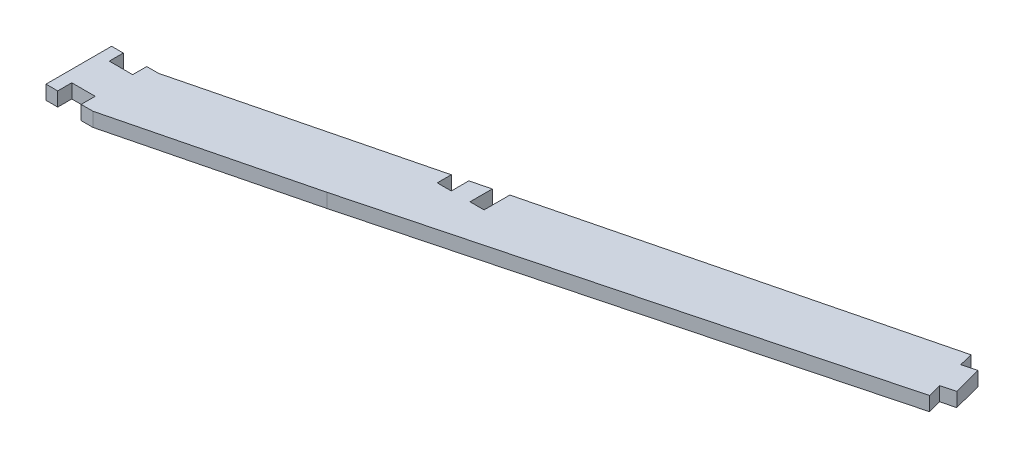
from build123d import *

# Parameters (mm, degrees)
BOSS_EXTRUDE1_DEPTH             = 15
BOSS_EXTRUDE2_REACH             = 1239.023
BOSS_EXTRUDE2_DIRECTION_2_REACH = 1239.023
CUT_EXTRUDE2_DEPTH              = 1238.578280352
CUT_EXTRUDE2_DEPTH_BACK         = 1238.578280352
SKETCH5_W                       = 40
SKETCH5_H                       = 40
CUT_EXTRUDE3_DEPTH              = 1238.578280352
BOSS_EXTRUDE4_DEPTH             = 75
CUT_EXTRUDE4_DEPTH              = 1241.107934819
CUT_EXTRUDE4_DEPTH_BACK         = 1241.107934819
SKETCH8_W                       = 15
SKETCH8_H                       = 73.7
FILLET1_R                       = 5
CUT_EXTRUDE5_DEPTH              = 1241.107934819
CUT_EXTRUDE5_DEPTH_BACK         = 1241.107934819
SKETCH9_W                       = 25
SKETCH9_H                       = 15
SKETCH9_W_2                     = 15
CUT_EXTRUDE6_DEPTH              = 1241.107934819
CUT_EXTRUDE6_DEPTH_BACK         = 1241.107934819
SKETCH10_W                      = 1728.920732784
SKETCH10_H                      = 178.853868908
SKETCH10_W_2                    = 1650
SKETCH10_H_2                    = 15
CUT_EXTRUDE9_DEPTH              = 1238.022635201
CUT_EXTRUDE9_DEPTH_BACK         = 1238.022635201
SKETCH11_W                      = 1852.680615207
SKETCH11_H                      = 1075.927112831


with BuildPart() as part:
    # Sketch1 → Boss-Extrude1 (new body)
    with BuildSketch(Plane(origin=(0, 0, 0), x_dir=(1, 0, 0), z_dir=(0, 1, 0))):
        Polygon((-450, 300), (-400, 300), (-200, 250), (600, 40), (1200, 40), (1200, -40), (600, -40), (-200, -250), (-400, -300), (-450, -300), align=None)
    extrude(amount=BOSS_EXTRUDE1_DEPTH)

    # Boss-Extrude2: up to this face of the body (flat: up to its plane)
    boss_extrude2_end = Plane(part.part.faces().sort_by_distance((-425, 7.5, 300))[0])
    # Sketch2 → Boss-Extrude2 (add, up to the picked face)
    with BuildSketch(Plane.XY, mode=Mode.PRIVATE) as boss_extrude2_sk1:
        with BuildLine():
            Line((-425, 0), (-450, 0))
            Line((-450, 0), (-450, -40))
            Line((-450, -40), (-440, -40))
            Line((-440, -40), (-440, -15))
            ThreePointArc((-440, -15), (-435.606601718, -4.393398282), (-425, 0))
        make_face()
    boss_extrude2_tool1 = split(extrude(boss_extrude2_sk1.sketch, amount=BOSS_EXTRUDE2_REACH, mode=Mode.PRIVATE), bisect_by=boss_extrude2_end, keep=Keep.BOTH, mode=Mode.PRIVATE)
    # Sketch2 → Boss-Extrude2 (add, up to the picked face)
    with BuildSketch(Plane.XY, mode=Mode.PRIVATE) as boss_extrude2_sk2:
        with BuildLine():
            Line((-400, 0), (-425, 0))
            ThreePointArc((-425, 0), (-414.393398282, -4.393398282), (-410, -15))
            Line((-410, -15), (-410, -40))
            Line((-410, -40), (-400, -40))
            Line((-400, -40), (-400, 0))
        make_face()
    boss_extrude2_tool2 = split(extrude(boss_extrude2_sk2.sketch, amount=BOSS_EXTRUDE2_REACH, mode=Mode.PRIVATE), bisect_by=boss_extrude2_end, keep=Keep.BOTH, mode=Mode.PRIVATE)
    add(boss_extrude2_tool1.solids().sort_by(Axis((-444.100555, -18.206662, 0), (0, 0, 1)))[0])
    add(boss_extrude2_tool2.solids().sort_by(Axis((-405.899445, -18.206662, 0), (0, 0, 1)))[0])

    # Boss-Extrude2 direction 2: up to this face of the body (flat: up to its plane)
    boss_extrude2_direction_2_end = Plane(part.part.faces().sort_by_distance((-425, 7.5, -300))[0])
    # Sketch2 → Boss-Extrude2 direction 2 (add, up to the picked face)
    with BuildSketch(Plane.XY, mode=Mode.PRIVATE) as boss_extrude2_direction_2_sk1:
        with BuildLine():
            Line((-425, 0), (-450, 0))
            Line((-450, 0), (-450, -40))
            Line((-450, -40), (-440, -40))
            Line((-440, -40), (-440, -15))
            ThreePointArc((-440, -15), (-435.606601718, -4.393398282), (-425, 0))
        make_face()
    boss_extrude2_direction_2_tool1 = split(extrude(boss_extrude2_direction_2_sk1.sketch, amount=-BOSS_EXTRUDE2_DIRECTION_2_REACH, mode=Mode.PRIVATE), bisect_by=boss_extrude2_direction_2_end, keep=Keep.BOTH, mode=Mode.PRIVATE)
    # Sketch2 → Boss-Extrude2 direction 2 (add, up to the picked face)
    with BuildSketch(Plane.XY, mode=Mode.PRIVATE) as boss_extrude2_direction_2_sk2:
        with BuildLine():
            Line((-400, 0), (-425, 0))
            ThreePointArc((-425, 0), (-414.393398282, -4.393398282), (-410, -15))
            Line((-410, -15), (-410, -40))
            Line((-410, -40), (-400, -40))
            Line((-400, -40), (-400, 0))
        make_face()
    boss_extrude2_direction_2_tool2 = split(extrude(boss_extrude2_direction_2_sk2.sketch, amount=-BOSS_EXTRUDE2_DIRECTION_2_REACH, mode=Mode.PRIVATE), bisect_by=boss_extrude2_direction_2_end, keep=Keep.BOTH, mode=Mode.PRIVATE)
    add(boss_extrude2_direction_2_tool1.solids().sort_by(Axis((-444.100555, -18.206662, 0), (0, 0, -1)))[0])
    add(boss_extrude2_direction_2_tool2.solids().sort_by(Axis((-405.899445, -18.206662, 0), (0, 0, -1)))[0])

    # Sketch4 → Cut-Extrude2 (cut, two sides: drawn at the far end of the back side and taken through both)
    with BuildSketch(Plane(origin=(0, 0, 0), x_dir=(1, 0, 0), z_dir=(0, 1, 0)).offset(-CUT_EXTRUDE2_DEPTH_BACK)):
        Polygon((-450, 230), (-400, 230), (-150, 167.5), (-150, -167.5), (-400, -230), (-450, -230), align=None)
        Polygon((-100, 155), (-100, -155), (520, 0), align=None)
    extrude(amount=CUT_EXTRUDE2_DEPTH + CUT_EXTRUDE2_DEPTH_BACK, mode=Mode.SUBTRACT)

    # Sketch5 → Cut-Extrude3 (cut, through all)
    with BuildSketch(Plane(origin=(0, 0, 0), x_dir=(0, 0, -1), z_dir=(1, 0, 0))):
        with Locations((-265, -20)):
            Rectangle(SKETCH5_W, SKETCH5_H)
        with Locations((265, -20)):
            Rectangle(SKETCH5_W, SKETCH5_H)
    extrude(amount=-CUT_EXTRUDE3_DEPTH, mode=Mode.SUBTRACT)

    # Sketch7 → Boss-Extrude4 (add)
    with BuildSketch(Plane(origin=(1200, 0, 0), x_dir=(0, 0, -1), z_dir=(1, 0, 0))):
        with BuildLine():
            Line((-87.5, 50), (-40, 15))
            Line((-40, 15), (40, 15))
            Line((40, 15), (87.5, 50))
            Line((87.5, 50), (87.5, 88.7))
            Line((87.5, 88.7), (58.5, 88.7))
            Line((58.5, 88.7), (58.5, 63.2))
            Line((58.5, 63.2), (48.5, 63.2))
            Line((48.5, 63.2), (48.5, 88.7))
            Line((48.5, 88.7), (20, 88.7))
            Line((20, 88.7), (20, 50))
            ThreePointArc((20, 50), (0, 30), (-20, 50))
            Line((-20, 50), (-20, 88.7))
            Line((-20, 88.7), (-63, 88.7))
            Line((-63, 88.7), (-63, 63.2))
            Line((-63, 63.2), (-73, 63.2))
            Line((-73, 63.2), (-73, 88.7))
            Line((-73, 88.7), (-87.5, 88.7))
            Line((-87.5, 88.7), (-87.5, 50))
        make_face()
    extrude(amount=-BOSS_EXTRUDE4_DEPTH)

    # Sketch8 → Cut-Extrude4 (cut, two sides: drawn at the far end of the back side and taken through both)
    with BuildSketch(Plane.XY.offset(-CUT_EXTRUDE4_DEPTH_BACK)):
        with Locations((1147.5, 51.85)):
            Rectangle(SKETCH8_W, SKETCH8_H)
        with Locations((1177.5, 51.85)):
            Rectangle(SKETCH8_W, SKETCH8_H)
    extrude(amount=CUT_EXTRUDE4_DEPTH + CUT_EXTRUDE4_DEPTH_BACK, mode=Mode.SUBTRACT)

    # Fillet1
    fillet1_edges = [part.edges().sort_by_distance(p)[0] for p in [
        (1192.5, 50, 87.5),
        (1162.5, 50, 87.5),
        (1132.5, 50, 87.5),
        (1192.5, 50, -87.5),
        (1162.5, 50, -87.5),
        (1132.5, 50, -87.5),
        (1192.5, 88.7, -87.5),
        (1162.5, 88.7, -87.5),
        (1132.5, 88.7, -87.5),
        (1132.5, 88.7, -58.5),
        (1162.5, 88.7, -58.5),
        (1192.5, 88.7, -58.5),
        (1192.5, 88.7, -48.5),
        (1162.5, 88.7, -48.5),
        (1132.5, 88.7, -48.5),
        (1192.5, 88.7, -20),
        (1162.5, 88.7, -20),
        (1132.5, 88.7, -20),
        (1192.5, 88.7, 63),
        (1162.5, 88.7, 63),
        (1132.5, 88.7, 63),
        (1132.5, 88.7, 87.5),
        (1162.5, 88.7, 87.5),
        (1192.5, 88.7, 87.5),
        (1192.5, 88.7, 73),
        (1162.5, 88.7, 73),
        (1132.5, 88.7, 73),
        (1192.5, 88.7, 20),
        (1162.5, 88.7, 20),
        (1132.5, 88.7, 20),
        (600, 7.5, 40),
        (600, 7.5, -40),
        (520, 7.5, 0),
        (-440, -40, -292.5),
        (-440, -40, -237.5),
        (-400, -40, -292.5),
        (-400, -40, -237.5),
        (-450, -40, -237.5),
        (-410, -40, -237.5),
        (-450, -40, -292.5),
        (-410, -40, -292.5),
        (-150, 7.5, 167.5),
        (-100, 7.5, 155),
        (-150, 7.5, -167.5),
        (-100, 7.5, -155),
        (-450, -40, 237.5),
        (-410, -40, 237.5),
        (-440, -40, 237.5),
        (-400, -40, 237.5),
        (-450, -40, 292.5),
        (-440, -40, 292.5),
        (-400, -40, 292.5),
        (-410, -40, 292.5),
    ]]
    fillet(fillet1_edges, radius=FILLET1_R - 0.0001)  # a hair under: the kernel refuses the full size

    # Sketch9 → Cut-Extrude5 (cut, two sides: drawn at the far end of the back side and taken through both)
    with BuildSketch(Plane(origin=(0, 0, 0), x_dir=(1, 0, 0), z_dir=(0, 1, 0)).offset(-CUT_EXTRUDE5_DEPTH_BACK)):
        with Locations((-425, -292.5)):
            Rectangle(SKETCH9_W, SKETCH9_H)
        with Locations((1192.5, -32.5)):
            Rectangle(SKETCH9_W_2, SKETCH9_H)
        with Locations((1192.5, 32.5)):
            Rectangle(SKETCH9_W_2, SKETCH9_H)
        with Locations((1162.5, 32.5)):
            Rectangle(SKETCH9_W_2, SKETCH9_H)
        with Locations((1132.5, 32.5)):
            Rectangle(SKETCH9_W_2, SKETCH9_H)
        with Locations((1132.5, -32.5)):
            Rectangle(SKETCH9_W_2, SKETCH9_H)
        with Locations((1162.5, -32.5)):
            Rectangle(SKETCH9_W_2, SKETCH9_H)
        with Locations((-425, -237.5)):
            Rectangle(SKETCH9_W, SKETCH9_H)
        with Locations((-425, 237.5)):
            Rectangle(SKETCH9_W, SKETCH9_H)
        with Locations((-425, 292.5)):
            Rectangle(SKETCH9_W, SKETCH9_H)
    extrude(amount=CUT_EXTRUDE5_DEPTH + CUT_EXTRUDE5_DEPTH_BACK, mode=Mode.SUBTRACT)


with BuildPart() as cut_extrude5_piece_1:
    # of the separate pieces the step leaves, piece 1, a body of its own (cut_extrude5_pieces)
    add(part.part.solids().sort_by_distance((-400, -35.0001, -300))[0])


with BuildPart() as cut_extrude5_piece_2:
    # of the separate pieces the step leaves, piece 2, a body of its own (cut_extrude5_pieces)
    add(part.part.solids().sort_by_distance((1170, 48.501289589, 85.46603587))[0])


with BuildPart() as cut_extrude5_piece_3:
    # of the separate pieces the step leaves, piece 3, a body of its own (cut_extrude5_pieces)
    add(part.part.solids().sort_by_distance((1170, 48.501289589, -85.46603587))[0])


with BuildPart() as cut_extrude5_piece_4:
    # of the separate pieces the step leaves, piece 4, a body of its own (cut_extrude5_pieces)
    add(part.part.solids().sort_by_distance((1125, 83.7001, 73))[0])


with BuildPart() as cut_extrude5_piece_5:
    # of the separate pieces the step leaves, piece 5, a body of its own (cut_extrude5_pieces)
    add(part.part.solids().sort_by_distance((1200, 48.501289589, 85.46603587))[0])


with BuildPart() as cut_extrude5_piece_6:
    # of the separate pieces the step leaves, piece 6, a body of its own (cut_extrude5_pieces)
    add(part.part.solids().sort_by_distance((1200, 48.501289589, -85.46603587))[0])


with BuildPart() as cut_extrude5_piece_7:
    # of the separate pieces the step leaves, piece 7, a body of its own (cut_extrude5_pieces)
    add(part.part.solids().sort_by_distance((1125, 88.7, -40))[0])


with BuildPart() as cut_extrude6_tool:
    # Sketch10 → Cut-Extrude6 (new, two sides: drawn at the far end of the back side and taken through both)
    with BuildSketch(Plane.XY.offset(-CUT_EXTRUDE6_DEPTH_BACK)):
        with Locations((378.379601058, 20.599691165)):
            Rectangle(SKETCH10_W, SKETCH10_H)
        with Locations((375, 7.5)):
            Rectangle(SKETCH10_W_2, SKETCH10_H_2, mode=Mode.SUBTRACT)
    extrude(amount=CUT_EXTRUDE6_DEPTH + CUT_EXTRUDE6_DEPTH_BACK)


with BuildPart() as cut_extrude5_piece_1_1:
    add(cut_extrude5_piece_1.part)

    # Cut-Extrude6: cut by cut_extrude6_tool
    add(cut_extrude6_tool.part, mode=Mode.SUBTRACT)

    # Sketch11 → Cut-Extrude9 (cut, two sides: drawn at the far end of the back side and taken through both)
    # profile 1 of 5: a face of its own
    with BuildSketch(Plane(origin=(0, 0, 0), x_dir=(1, 0, 0), z_dir=(0, 1, 0)).offset(-CUT_EXTRUDE9_DEPTH_BACK)):
        with Locations((324.970767393, -26.108881651)):
            Rectangle(SKETCH11_W, SKETCH11_H)
        Polygon((309.276307823, -116.314969197), (-450, -315.625), (-450, -242.5), (-450, -230), (-400, -230), (-150, -167.5), (-135, -163.75), (-115, -158.75), (-100, -155), (293.601058917, -56.599735271), (308.154197556, -52.961450611), (311.917995324, -67.299727825), (319.976300377, -97.99803279), (323.784772304, -112.50649727), align=None, mode=Mode.SUBTRACT)
    # profile 2 of 5: a face of its own
    with BuildSketch(Plane(origin=(0, 0, 0), x_dir=(1, 0, 0), z_dir=(0, 1, 0)).offset(-CUT_EXTRUDE9_DEPTH_BACK)):
        Polygon((-135, -163.75), (-150, -167.5), (-150, -182.5), (-135, -182.5), align=None)
    # profile 3 of 5: a face of its own
    with BuildSketch(Plane(origin=(0, 0, 0), x_dir=(1, 0, 0), z_dir=(0, 1, 0)).offset(-CUT_EXTRUDE9_DEPTH_BACK)):
        Polygon((-100, -155), (-115, -158.75), (-115, -182.5), (-100, -182.5), align=None)
    # profile 4 of 5: a face of its own
    with BuildSketch(Plane(origin=(0, 0, 0), x_dir=(1, 0, 0), z_dir=(0, 1, 0)).offset(-CUT_EXTRUDE9_DEPTH_BACK)):
        Polygon((305.467835897, -101.806504716), (309.276307823, -116.314969197), (323.784772304, -112.50649727), (319.976300377, -97.99803279), align=None)
    # profile 5 of 5: a face of its own
    with BuildSketch(Plane(origin=(0, 0, 0), x_dir=(1, 0, 0), z_dir=(0, 1, 0)).offset(-CUT_EXTRUDE9_DEPTH_BACK)):
        Polygon((297.409530844, -71.108199751), (311.917995324, -67.299727825), (308.154197556, -52.961450611), (293.601058917, -56.599735271), align=None)
    extrude(amount=CUT_EXTRUDE9_DEPTH + CUT_EXTRUDE9_DEPTH_BACK, mode=Mode.SUBTRACT)


with BuildPart() as cut_extrude5_piece_2_1:
    add(cut_extrude5_piece_2.part)

    # Cut-Extrude6: cut by cut_extrude6_tool
    add(cut_extrude6_tool.part, mode=Mode.SUBTRACT)


with BuildPart() as cut_extrude5_piece_3_1:
    add(cut_extrude5_piece_3.part)

    # Cut-Extrude6: cut by cut_extrude6_tool
    add(cut_extrude6_tool.part, mode=Mode.SUBTRACT)


with BuildPart() as cut_extrude5_piece_4_1:
    add(cut_extrude5_piece_4.part)

    # Cut-Extrude6: cut by cut_extrude6_tool
    add(cut_extrude6_tool.part, mode=Mode.SUBTRACT)


with BuildPart() as cut_extrude5_piece_5_1:
    add(cut_extrude5_piece_5.part)

    # Cut-Extrude6: cut by cut_extrude6_tool
    add(cut_extrude6_tool.part, mode=Mode.SUBTRACT)


with BuildPart() as cut_extrude5_piece_6_1:
    add(cut_extrude5_piece_6.part)

    # Cut-Extrude6: cut by cut_extrude6_tool
    add(cut_extrude6_tool.part, mode=Mode.SUBTRACT)


with BuildPart() as cut_extrude5_piece_7_1:
    add(cut_extrude5_piece_7.part)

    # Cut-Extrude6: cut by cut_extrude6_tool
    add(cut_extrude6_tool.part, mode=Mode.SUBTRACT)


solid = cut_extrude5_piece_1_1.part
